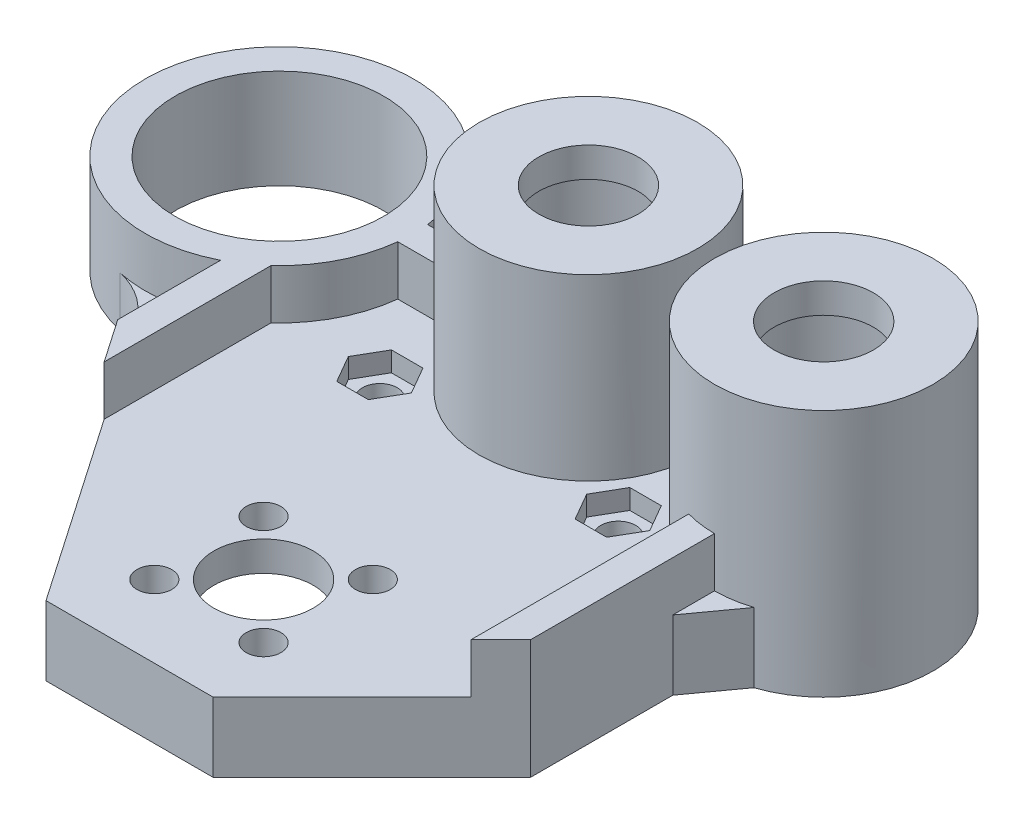
from build123d import *
from build123d.topology import SkipClean

# Parameters (mm, degrees)
SKETCH3_R               = 8
SKETCH3_W               = 54.803
SKETCH3_H               = 32
SKETCH3_R_2             = 5
BOSS_EXTRUDE1_DEPTH     = 7
CUT_EXTRUDE3_DEPTH      = 65.105926161
CUT_EXTRUDE3_DEPTH_BACK = 65.105926161
SKETCH4_R               = 1.75
SKETCH6_R               = 11
SKETCH6_R_2             = 8
BOSS_EXTRUDE2_DEPTH     = 15
SKETCH7_R               = 11
SKETCH7_R_2             = 5
BOSS_EXTRUDE3_DEPTH     = 3
CHAMFER1_SIZE           = 2.5
CUT_EXTRUDE4_DEPTH      = 2
CUT_EXTRUDE5_DEPTH      = 69.451221823
CUT_EXTRUDE5_DEPTH_BACK = 69.451221823
SKETCH9_R               = 1.75
CUT_EXTRUDE6_START      = -2
SKETCH10_R              = 1.75
CUT_EXTRUDE6_DEPTH      = 2
CHAMFER3_SIZE           = 32
CHAMFER3_SIZE2          = 22
CHAMFER4_SIZE           = 16
FILLET1_R               = 8
SKETCH12_R              = 10.5
BOSS_EXTRUDE4_DEPTH     = 5
BOSS_EXTRUDE5_DEPTH     = 5
SKETCH14_R              = 11.5
SKETCH14_R_2            = 5
SKETCH14_R_3            = 1.75
CUT_EXTRUDE8_DEPTH      = 4
FILLET2_R               = 3


with BuildPart() as part:
    # Sketch3 → Boss-Extrude1 (new body)
    # profile 1 of 10: a face of its own
    with BuildSketch(Plane(origin=(0, 0, 0), x_dir=(1, 0, 0), z_dir=(0, 1, 0))):
        with BuildLine():
            ThreePointArc((-17.613, 0), (-21.567058454, 9.545941546), (-31.113, 13.5))
            Line((-31.113, 13.5), (-31.113, 10.5))
            ThreePointArc((-31.113, 10.5), (-23.688378798, 7.424621202), (-20.613, 0))
            ThreePointArc((-20.613, 0), (-23.688378798, -7.424621202), (-31.113, -10.5))
            Line((-31.113, -10.5), (-31.113, -13.5))
            ThreePointArc((-31.113, -13.5), (-21.567058454, -9.545941546), (-17.613, 0))
        make_face()
    # profile 2 of 10: a face of its own
    with BuildSketch(Plane(origin=(0, 0, 0), x_dir=(1, 0, 0), z_dir=(0, 1, 0))):
        with BuildLine():
            Line((-31.113, 10.5), (-31.113, 13.5))
            ThreePointArc((-31.113, 13.5), (-44.613, 0), (-31.113, -13.5))
            Line((-31.113, -13.5), (-31.113, -10.5))
            ThreePointArc((-31.113, -10.5), (-41.613, 0), (-31.113, 10.5))
        make_face()
    # profile 3 of 10: a face of its own
    with BuildSketch(Plane(origin=(0, 0, 0), x_dir=(1, 0, 0), z_dir=(0, 1, 0))):
        with BuildLine():
            Line((23.69, 13.5), (-31.113, 13.5))
            ThreePointArc((-31.113, 13.5), (-21.567058454, 9.545941546), (-17.613, 0))
            ThreePointArc((-17.613, 0), (-21.567058454, -9.545941546), (-31.113, -13.5))
            Line((-31.113, -13.5), (23.69, -13.5))
            Line((23.69, -13.5), (23.69, -11))
            ThreePointArc((23.69, -11), (12.69, 0), (23.69, 11))
            Line((23.69, 11), (23.69, 13.5))
        make_face()
        with Locations(Location((0, 0, 0), (0, 0, 270))):
            Circle(SKETCH3_R, mode=Mode.SUBTRACT)
    # profile 4 of 10: a face of its own
    with BuildSketch(Plane(origin=(0, 0, 0), x_dir=(1, 0, 0), z_dir=(0, 1, 0))):
        with BuildLine():
            ThreePointArc((-17.613, 0), (-21.567058454, 9.545941546), (-31.113, 13.5))
            Line((-31.113, 13.5), (-31.113, 10.5))
            ThreePointArc((-31.113, 10.5), (-23.688378798, 7.424621202), (-20.613, 0))
            ThreePointArc((-20.613, 0), (-23.688378798, -7.424621202), (-31.113, -10.5))
            Line((-31.113, -10.5), (-31.113, -13.5))
            ThreePointArc((-31.113, -13.5), (-21.567058454, -9.545941546), (-17.613, 0))
        make_face()
    # profile 5 of 10: a face of its own
    with BuildSketch(Plane(origin=(0, 0, 0), x_dir=(1, 0, 0), z_dir=(0, 1, 0))):
        with BuildLine():
            Line((-31.113, 10.5), (-31.113, 13.5))
            ThreePointArc((-31.113, 13.5), (-44.613, 0), (-31.113, -13.5))
            Line((-31.113, -13.5), (-31.113, -10.5))
            ThreePointArc((-31.113, -10.5), (-41.613, 0), (-31.113, 10.5))
        make_face()
    # profile 6 of 10: a face of its own
    with BuildSketch(Plane(origin=(0, 0, 0), x_dir=(1, 0, 0), z_dir=(0, 1, 0))):
        with BuildLine():
            ThreePointArc((34.69, 0), (31.468174593, 7.778174593), (23.69, 11))
            Line((23.69, 11), (23.69, 8))
            ThreePointArc((23.69, 8), (29.346854249, 5.656854249), (31.69, 0))
            ThreePointArc((31.69, 0), (29.346854249, -5.656854249), (23.69, -8))
            Line((23.69, -8), (23.69, -11))
            ThreePointArc((23.69, -11), (31.468174593, -7.778174593), (34.69, 0))
        make_face()
    # profile 7 of 10: a face of its own
    with BuildSketch(Plane(origin=(0, 0, 0), x_dir=(1, 0, 0), z_dir=(0, 1, 0))):
        with BuildLine():
            Line((23.69, 8), (23.69, 11))
            ThreePointArc((23.69, 11), (12.69, 0), (23.69, -11))
            Line((23.69, -11), (23.69, -8))
            ThreePointArc((23.69, -8), (15.69, 0), (23.69, 8))
        make_face()
    # profile 8 of 10: a face of its own
    with BuildSketch(Plane(origin=(0, 0, 0), x_dir=(1, 0, 0), z_dir=(0, 1, 0))):
        with Locations((-3.7115, -29.5)):
            Rectangle(SKETCH3_W, SKETCH3_H)
        with Locations(Location((0, -32.707574931, 0), (0, 0, 270))):
            Circle(SKETCH3_R_2, mode=Mode.SUBTRACT)
    # profile 9 of 10: a face of its own
    with BuildSketch(Plane(origin=(0, 0, 0), x_dir=(1, 0, 0), z_dir=(0, 1, 0))):
        with BuildLine():
            ThreePointArc((34.69, 0), (31.468174593, 7.778174593), (23.69, 11))
            Line((23.69, 11), (23.69, 8))
            ThreePointArc((23.69, 8), (29.346854249, 5.656854249), (31.69, 0))
            ThreePointArc((31.69, 0), (29.346854249, -5.656854249), (23.69, -8))
            Line((23.69, -8), (23.69, -11))
            ThreePointArc((23.69, -11), (31.468174593, -7.778174593), (34.69, 0))
        make_face()
    # profile 10 of 10: a face of its own
    with BuildSketch(Plane(origin=(0, 0, 0), x_dir=(1, 0, 0), z_dir=(0, 1, 0))):
        with BuildLine():
            Line((23.69, 8), (23.69, 11))
            ThreePointArc((23.69, 11), (12.69, 0), (23.69, -11))
            Line((23.69, -11), (23.69, -8))
            ThreePointArc((23.69, -8), (15.69, 0), (23.69, 8))
        make_face()
    extrude(amount=BOSS_EXTRUDE1_DEPTH)

    # Sketch4 → Cut-Extrude3 (cut, two sides: drawn at the far end of the back side and taken through both)
    with BuildSketch(Plane(origin=(0, 0, 0), x_dir=(1, 0, 0), z_dir=(0, 1, 0)).offset(-CUT_EXTRUDE3_DEPTH_BACK)):
        with Locations(Location((5.5, -27.207574931, 0), (0, 0, 270))):
            Circle(SKETCH4_R)
        with Locations(Location((5.5, -38.207574931, 0), (0, 0, 270))):
            Circle(SKETCH4_R)
        with Locations(Location((-5.5, -38.207574931, 0), (0, 0, 270))):
            Circle(SKETCH4_R)
        with Locations(Location((-5.5, -27.207574931, 0), (0, 0, 270))):
            Circle(SKETCH4_R)
    extrude(amount=CUT_EXTRUDE3_DEPTH + CUT_EXTRUDE3_DEPTH_BACK, mode=Mode.SUBTRACT)

    # Sketch6 → Boss-Extrude2 (add)
    # profile 1 of 2: a face of its own
    with BuildSketch(Plane(origin=(0, 7, 0), x_dir=(1, 0, 0), z_dir=(0, 1, 0))):
        with Locations(Location((23.69, 0, 0), (0, 0, 270))):
            Circle(SKETCH6_R)
        with Locations(Location((23.69, 0, 0), (0, 0, 270))):
            Circle(SKETCH6_R_2, mode=Mode.SUBTRACT)
    # profile 2 of 2: a face of its own
    with BuildSketch(Plane(origin=(0, 7, 0), x_dir=(1, 0, 0), z_dir=(0, 1, 0))):
        with Locations(Location((0, 0, 0), (0, 0, 270))):
            Circle(SKETCH6_R)
        with Locations(Location((0, 0, 0), (0, 0, 270))):
            Circle(SKETCH6_R_2, mode=Mode.SUBTRACT)
    extrude(amount=BOSS_EXTRUDE2_DEPTH)

    # Sketch7 → Boss-Extrude3 (add)
    # profile 1 of 2: a face of its own
    with BuildSketch(Plane(origin=(0, 22, 0), x_dir=(1, 0, 0), z_dir=(0, 1, 0))):
        with Locations(Location((23.69, 0, 0), (0, 0, 270))):
            Circle(SKETCH7_R)
        with Locations(Location((23.69, 0, 0), (0, 0, 270))):
            Circle(SKETCH7_R_2, mode=Mode.SUBTRACT)
    # profile 2 of 2: a face of its own
    with BuildSketch(Plane(origin=(0, 22, 0), x_dir=(1, 0, 0), z_dir=(0, 1, 0))):
        with Locations(Location((0, 0, 0), (0, 0, 270))):
            Circle(SKETCH7_R)
        with Locations(Location((0, 0, 0), (0, 0, 270))):
            Circle(SKETCH7_R_2, mode=Mode.SUBTRACT)
    extrude(amount=BOSS_EXTRUDE3_DEPTH)

    # Chamfer1
    # the kernel refuses this chamfer: 2.5 mm, written as the material it adds along each edge
    with BuildSketch(Plane(origin=(23.69, 0, -11), x_dir=(0.9912092295509807, 0, 0.13230367815352426), z_dir=(0, 1, 0))) as chamfer1_piece_1_section:
        with BuildLine():
            Line((2.910680919, 0), (-CHAMFER1_SIZE * 0.132303678154, CHAMFER1_SIZE * 0.991209229551))
            Line((-CHAMFER1_SIZE * 0.132303678154, CHAMFER1_SIZE * 0.991209229551), (0, 0))
            ThreePointArc((0, 0), (1.49552658, 0.096625069), (2.910680919, 0))
        make_face()
    chamfer1_piece_1 = extrude(amount=7, mode=Mode.PRIVATE)
    chamfer1_piece_1 = split(chamfer1_piece_1, bisect_by=Plane(origin=(23.69, 0, -13.5), z_dir=(0, 0, 1)), keep=Keep.TOP, mode=Mode.PRIVATE)
    add(chamfer1_piece_1)

    # Sketch8 → Cut-Extrude4 (cut)
    with BuildSketch(Plane(origin=(0, 0, 0), x_dir=(1, 0, 0), z_dir=(0, 1, 0))):
        Polygon((-31.113, -12.25), (-31.113, 0), (-31.113, 12.25), (-31.113, 13.5), (-51.113, 13.5), (-51.113, -13.5), (-31.113, -13.5), align=None)
        Polygon((-31.113, 12.25), (-31.113, 0), (-31.113, -12.25), (-13.613, -6.5), (-13.613, 6.5), align=None)
    extrude(amount=CUT_EXTRUDE4_DEPTH, mode=Mode.SUBTRACT)

    # Sketch9 → Cut-Extrude5 (cut, two sides: drawn at the far end of the back side and taken through both)
    with BuildSketch(Plane(origin=(0, 0, 0), x_dir=(1, 0, 0), z_dir=(0, 1, 0)).offset(-CUT_EXTRUDE5_DEPTH_BACK)):
        with Locations(Location((12, 9, 0), (0, 0, 90))):
            Circle(SKETCH9_R)
        with Locations(Location((12, -9, 0), (0, 0, 90))):
            Circle(SKETCH9_R)
        with Locations(Location((-12, -9, 0), (0, 0, 90))):
            Circle(SKETCH9_R)
        with Locations(Location((-12, 9, 0), (0, 0, 90))):
            Circle(SKETCH9_R)
    extrude(amount=CUT_EXTRUDE5_DEPTH + CUT_EXTRUDE5_DEPTH_BACK, mode=Mode.SUBTRACT)

    # Sketch10 → Cut-Extrude6 (cut)
    # profile 1 of 4: a face of its own
    with BuildSketch(Plane(origin=(0, 7, 0), x_dir=(1, 0, 0), z_dir=(0, 1, 0)).offset(CUT_EXTRUDE6_START)):
        Polygon((-15.175426481, -9), (-13.58771324, -11.75), (-10.41228676, -11.75), (-8.824573519, -9), (-10.41228676, -6.25), (-13.58771324, -6.25), align=None)
        with Locations(Location((-12, -9, 0), (0, 0, 90))):
            Circle(SKETCH10_R, mode=Mode.SUBTRACT)
    # profile 2 of 4: a face of its own
    with BuildSketch(Plane(origin=(0, 7, 0), x_dir=(1, 0, 0), z_dir=(0, 1, 0)).offset(CUT_EXTRUDE6_START)):
        Polygon((-15.175426481, 9), (-13.58771324, 6.25), (-10.41228676, 6.25), (-8.824573519, 9), (-10.41228676, 11.75), (-13.58771324, 11.75), align=None)
        with Locations(Location((-12, 9, 0), (0, 0, 90))):
            Circle(SKETCH10_R, mode=Mode.SUBTRACT)
    # profile 3 of 4: a face of its own
    with BuildSketch(Plane(origin=(0, 7, 0), x_dir=(1, 0, 0), z_dir=(0, 1, 0)).offset(CUT_EXTRUDE6_START)):
        Polygon((15.175426481, 9), (13.58771324, 11.75), (10.41228676, 11.75), (8.824573519, 9), (10.41228676, 6.25), (13.58771324, 6.25), align=None)
        with Locations(Location((12, 9, 0), (0, 0, 90))):
            Circle(SKETCH10_R, mode=Mode.SUBTRACT)
    # profile 4 of 4: a face of its own
    with BuildSketch(Plane(origin=(0, 7, 0), x_dir=(1, 0, 0), z_dir=(0, 1, 0)).offset(CUT_EXTRUDE6_START)):
        Polygon((15.175426481, -9), (13.58771324, -6.25), (10.41228676, -6.25), (8.824573519, -9), (10.41228676, -11.75), (13.58771324, -11.75), align=None)
        with Locations(Location((12, -9, 0), (0, 0, 90))):
            Circle(SKETCH10_R, mode=Mode.SUBTRACT)
    extrude(amount=CUT_EXTRUDE6_DEPTH, mode=Mode.SUBTRACT)

    # Chamfer2
    # the kernel refuses this chamfer: 5 mm, written as the material it adds along each edge
    with BuildSketch(Plane(origin=(23.69, 0, 11), x_dir=(0.9874000606639179, 0, -0.15824386307497393), z_dir=(0, 1, 0))) as chamfer2_piece_1:
        with BuildLine():
            Line((3.622786344, 0.141421356), (-0.805837357, -4.287202344))
            Line((-0.805837357, -4.287202344), (-0.904577363, -4.271377958))
            ThreePointArc((-0.904577363, -4.271377958), (-0.443767224, -2.137054655), (-0.098740006, 0.015824386))
            Line((-0.098740006, 0.015824386), (0.015824386, 0.098740006))
            ThreePointArc((0.015824386, 0.098740006), (1.81210794, -0.038365312), (3.606961958, 0.240161362))
            Line((3.606961958, 0.240161362), (3.622786344, 0.141421356))
        make_face()
    extrude(amount=7)

    # Chamfer3
    chamfer3_edges = [part.edges().sort_by_distance(p)[0] for p in [
        (-31.113, 3.5, 45.5),
    ]]
    chamfer3_side = [part.faces().sort_by_distance(p)[0] for p in [
        (-31.113, 3.472406181, 29.316501104),
    ]]
    chamfer(chamfer3_edges, length=CHAMFER3_SIZE, length2=CHAMFER3_SIZE2, reference=chamfer3_side[0])

    # Chamfer4
    chamfer4_edges = [part.edges().sort_by_distance(p)[0] for p in [
        (23.69, 3.5, 45.5),
    ]]
    chamfer(chamfer4_edges, length=CHAMFER4_SIZE)

    # Fillet1
    fillet1_edges = [part.edges().sort_by_distance(p)[0] for p in [
        (-31.113, 4.5, 13.5),
    ]]
    fillet(fillet1_edges, radius=FILLET1_R)

    # Sketch12 → Boss-Extrude4 (add)
    # profile 1 of 4: a face of its own
    with BuildSketch(Plane(origin=(0, 7, 0), x_dir=(1, 0, 0), z_dir=(0, 1, 0))):
        with BuildLine():
            ThreePointArc((11, 0), (10.974281775, -0.751757625), (10.897247359, -1.5))
            Line((10.897247359, -1.5), (12.792752641, -1.5))
            ThreePointArc((12.792752641, -1.5), (12.69, 0), (12.792752641, 1.5))
            Line((12.792752641, 1.5), (10.897247359, 1.5))
            ThreePointArc((10.897247359, 1.5), (10.974281775, 0.751757625), (11, 0))
        make_face()
    # profile 2 of 4: a face of its own
    with BuildSketch(Plane(origin=(0, 7, 0), x_dir=(1, 0, 0), z_dir=(0, 1, 0))):
        with BuildLine():
            ThreePointArc((-17.613, 0), (-17.633914234, -0.751163705), (-17.696592135, -1.5))
            Line((-17.696592135, -1.5), (-10.897247359, -1.5))
            ThreePointArc((-10.897247359, -1.5), (-11, 0), (-10.897247359, 1.5))
            Line((-10.897247359, 1.5), (-17.696592135, 1.5))
            ThreePointArc((-17.696592135, 1.5), (-17.633914234, 0.751163705), (-17.613, 0))
        make_face()
    # profile 3 of 4: a face of its own
    with BuildSketch(Plane(origin=(0, 7, 0), x_dir=(1, 0, 0), z_dir=(0, 1, 0))):
        with BuildLine():
            Line((-17.696592135, -1.5), (-19.418433475, -1.5))
            Line((-19.418433475, -1.5), (-19.418433475, 1.5))
            Line((-19.418433475, 1.5), (-17.696592135, 1.5))
            ThreePointArc((-17.696592135, 1.5), (-22.113, 10.062305899), (-31.113, 13.5))
            ThreePointArc((-31.113, 13.5), (-44.536619079, 1.434033058), (-33.96483904, -13.19534062))
            ThreePointArc((-33.96483904, -13.19534062), (-23.232785747, -10.961396961), (-17.696592135, -1.5))
        make_face()
        with Locations(Location((-31.113, 0, 0), (0, 0, 270))):
            Circle(SKETCH12_R, mode=Mode.SUBTRACT)
    # profile 4 of 4: a face of its own
    with BuildSketch(Plane(origin=(0, 7, 0), x_dir=(1, 0, 0), z_dir=(0, 1, 0))):
        with BuildLine():
            Line((-19.418433475, 1.5), (-19.418433475, -1.5))
            Line((-19.418433475, -1.5), (-17.696592135, -1.5))
            ThreePointArc((-17.696592135, -1.5), (-17.633914234, -0.751163705), (-17.613, 0))
            ThreePointArc((-17.613, 0), (-17.633914234, 0.751163705), (-17.696592135, 1.5))
            Line((-17.696592135, 1.5), (-19.418433475, 1.5))
        make_face()
    extrude(amount=BOSS_EXTRUDE4_DEPTH)

    # Sketch13 → Boss-Extrude5 (add)
    with BuildSketch(Plane(origin=(0, 7, 0), x_dir=(1, 0, 0), z_dir=(0, 1, 0))):
        with BuildLine():
            Line((23.69, -29.5), (23.69, -15.198684154))
            Line((23.69, -15.198684154), (23.69, -11))
            ThreePointArc((23.69, -11), (22.175578937, -10.895252583), (20.69, -10.583005244))
            Line((20.69, -10.583005244), (20.69, -32.5))
            Line((20.69, -32.5), (23.69, -29.5))
        make_face()
        with BuildLine():
            Line((-25, -22.391636364), (-22, -26.755272727))
            Line((-22, -26.755272727), (-22, -9.960081877))
            ThreePointArc((-22, -9.960081877), (-23.429523235, -11.100188503), (-25, -12.036661954))
            Line((-25, -12.036661954), (-25, -22.391636364))
        make_face()
    extrude(amount=BOSS_EXTRUDE5_DEPTH)

    # Sketch14 → Cut-Extrude8 (cut)
    with SkipClean():  # the faces are left unmerged after this step: merging them gives an invalid solid
        with BuildSketch(Plane.XZ):
            with Locations(Location((0, 32.707574931, 0), (0, 0, 270))):
                Circle(SKETCH14_R)
            with Locations(Location((0, 32.707574931, 0), (0, 0, 270))):
                Circle(SKETCH14_R_2, mode=Mode.SUBTRACT)
            with Locations(Location((5.5, 38.207574931, 0), (0, 0, 270))):
                Circle(SKETCH14_R_3, mode=Mode.SUBTRACT)
            with Locations(Location((-5.5, 27.207574931, 0), (0, 0, 270))):
                Circle(SKETCH14_R_3, mode=Mode.SUBTRACT)
            with Locations(Location((-5.5, 38.207574931, 0), (0, 0, 270))):
                Circle(SKETCH14_R_3, mode=Mode.SUBTRACT)
            with Locations(Location((5.5, 27.207574931, 0), (0, 0, 270))):
                Circle(SKETCH14_R_3, mode=Mode.SUBTRACT)
        extrude(amount=-CUT_EXTRUDE8_DEPTH, mode=Mode.SUBTRACT)

    # Fillet2
    # the kernel refuses this fillet: 3 mm, written as the material it takes off along each edge
    with BuildSketch(Plane(origin=(-31.113, -5.001031038, -12.25), x_dir=(0.9500317490404903, 0, 0.3121532889704462), z_dir=(0, 1, 0))) as fillet2_piece_1:
        with BuildLine():
            CenterArc((2.000412415, 3), FILLET2_R, 217.167948486, 52.832051514)
            Line((-0.390191611, 1.187539686), (-0.438003692, 1.15129048))
            ThreePointArc((-0.438003692, 1.15129048), (-0.252097711, 0.575040646), (-0.057001905, -0.018729197))
            Line((-0.057001905, -0.018729197), (0, -0.06))
            Line((0, -0.06), (2.000412415, -0.06))
            Line((2.000412415, -0.06), (2.000412415, 0))
        make_face()
    extrude(amount=7.001031038, mode=Mode.SUBTRACT)
    with BuildSketch(Plane(origin=(-31.113, -5.001031038, 12.25), x_dir=(0, 0, 1), z_dir=(0, 1, 0))) as fillet2_piece_2:
        with BuildLine():
            CenterArc((2.225659932, 2.836915173), FILLET2_R, 198.1890457, 52.832051514)
            Line((-0.624435315, 1.900455306), (-0.68143722, 1.881726108))
            Line((-0.68143722, 1.881726108), (-0.057001905, -0.018729197))
            Line((-0.057001905, -0.018729197), (0, -0.06))
            ThreePointArc((0, -0.06), (0.625, -0.06), (1.230486801, -0.056738303))
            Line((1.230486801, -0.056738303), (1.25, 0))
        make_face()
    extrude(amount=7.001031038, mode=Mode.SUBTRACT)


solid = part.part
